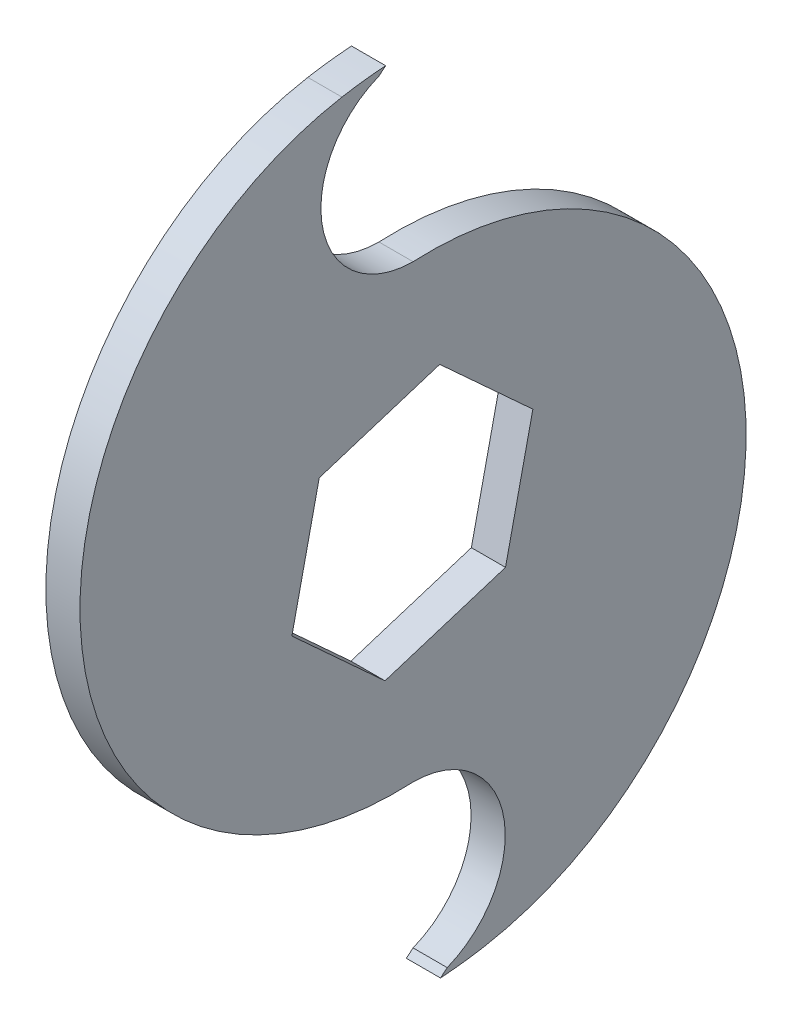
from build123d import *

# Parameters (mm, degrees)
BOSS_EXTRUDE1_DEPTH = 5
CUT_EXTRUDE1_DEPTH  = 6
CAVITY1_DEPTH       = 5


# Read off the part's stored shape, not the designer's step: Cavity1
with BuildPart() as part:
    # Sketch3 → Boss-Extrude1 (new body)
    with BuildSketch(Plane(origin=(0, 0, 0), x_dir=(0, 0, -1), z_dir=(1, 0, 0))):
        with BuildLine():
            ThreePointArc((0, 60), (-13.5, 46.5), (0, 33))
            ThreePointArc((0, 33), (48.489461609, -8.147530745), (10.41889066, -59.088465181))
            ThreePointArc((10.41889066, -59.088465181), (5.229344565, -59.771681886), (0, -60))
            ThreePointArc((0, -60), (13.5, -46.5), (0, -33))
            ThreePointArc((0, -33), (-48.489461609, 8.147530745), (-10.41889066, 59.088465181))
            ThreePointArc((-10.41889066, 59.088465181), (-5.229344565, 59.771681886), (0, 60))
        make_face()
    extrude(amount=BOSS_EXTRUDE1_DEPTH)

    # Sketch5 → Cut-Extrude1 (cut)
    with BuildSketch(Plane(origin=(0, 0, 0), x_dir=(0, 0, -1), z_dir=(1, 0, 0))):
        Polygon((-5, 59.039936204), (0, 63.23543436), (4.195498156, 58.23543436), (-0.804501844, 54.039936204), align=None)
        Polygon((5, -59.039936204), (0, -63.23543436), (-4.195498156, -58.23543436), (0.804501844, -54.039936204), align=None)
    extrude(amount=CUT_EXTRUDE1_DEPTH, mode=Mode.SUBTRACT)

    # Cavity1 outline → Cavity1 (cut)
    with BuildSketch(Plane.YZ):
        Polygon((-18.108015498, 4.108286468), (-12.544428042, -13.539583883), (5.520869734, -17.545310986), (18.022580053, -3.903167737), (12.458992597, 13.744702615), (-5.606305179, 17.750429717), align=None)
    extrude(amount=CAVITY1_DEPTH, mode=Mode.SUBTRACT)


solid = part.part
